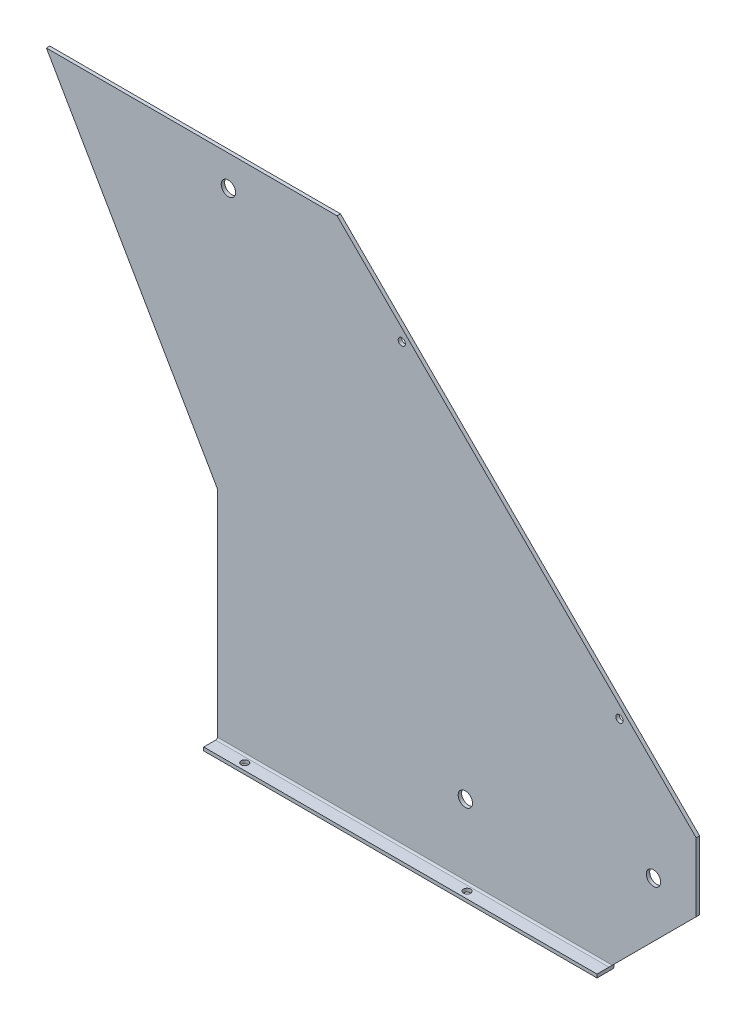
from build123d import *

# Parameters (mm, degrees)
BOSS_EXTRU_1_DEPTH      = 2
ESQUISSE2_W             = 230
ESQUISSE2_H             = 10
BOSS_EXTRU_2_DEPTH      = 2
CONG_1_R                = 1
ESQUISSE3_R             = 4.2
ENL_V_MAT_EXTRU_1_DEPTH = 285.197114693
ESQUISSE5_R             = 2.1
ENL_V_MAT_EXTRU_2_DEPTH = 385.317577012
ESQUISSE6_R             = 2.1
ENL_V_MAT_EXTRU_3_DEPTH = 285.197114693


with BuildPart() as part:
    # Esquisse1 → Boss.-Extru.1 (new body)
    with BuildSketch(Plane.XY):
        Polygon((140, -60), (-70, 150), (-140, 150), (-240, 150), (-140, -23.205080757), (-140, -150), (90, -150), (140, -100), align=None)
    extrude(amount=BOSS_EXTRU_1_DEPTH)

    # Esquisse2 → Boss.-Extru.2 (add)
    with BuildSketch(Plane.XZ.offset(150)):
        with Locations((-25, 5)):
            Rectangle(ESQUISSE2_W, ESQUISSE2_H)
    extrude(amount=BOSS_EXTRU_2_DEPTH)

    # Congé1
    cong_1_edges = [part.edges().sort_by_distance(p)[0] for p in [
        (-25, -152, 0),
        (-25, -150, 2),
    ]]
    fillet(cong_1_edges, radius=CONG_1_R)

    # Esquisse3 → Enlèv. mat.-Extru.1 (cut, through all)
    with BuildSketch(Plane.XY.offset(2)):
        with Locations((-133.564064606, 132.10753113)):
            Circle(ESQUISSE3_R)
        with Locations((5, -107.89246887)):
            Circle(ESQUISSE3_R)
        with Locations((115, -92.89246887)):
            Circle(ESQUISSE3_R)
    extrude(amount=-ENL_V_MAT_EXTRU_1_DEPTH, mode=Mode.SUBTRACT)

    # Esquisse5 → Enlèv. mat.-Extru.2 (cut, through all)
    with BuildSketch(Plane(origin=(0, -150, 0), x_dir=(1, 0, 0), z_dir=(0, 1, 0))):
        with Locations((10, -6)):
            Circle(ESQUISSE5_R)
        with Locations((-120, -6)):
            Circle(ESQUISSE5_R)
    extrude(amount=-ENL_V_MAT_EXTRU_2_DEPTH, mode=Mode.SUBTRACT)

    # Esquisse6 → Enlèv. mat.-Extru.3 (cut, through all)
    with BuildSketch(Plane.XY.offset(2)):
        with Locations((-32.175144213, 105.104076401)):
            Circle(ESQUISSE6_R)
        with Locations((95.104076401, -22.175144213)):
            Circle(ESQUISSE6_R)
    extrude(amount=-ENL_V_MAT_EXTRU_3_DEPTH, mode=Mode.SUBTRACT)


solid = part.part
